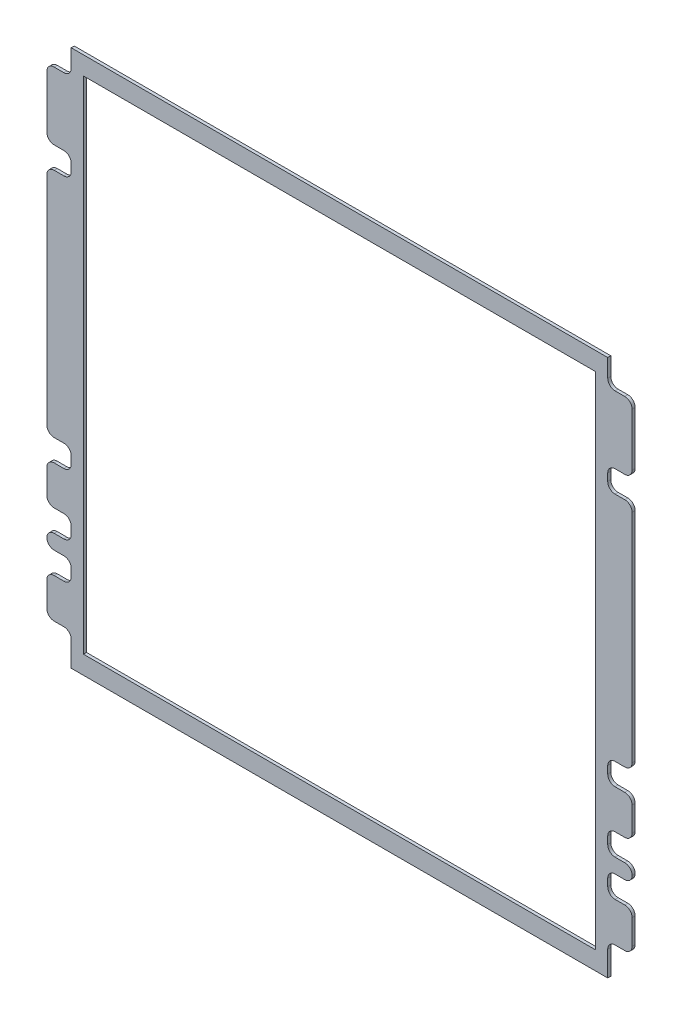
from build123d import *

# Parameters (mm, degrees)
SKETCH1_W           = 609.6
SKETCH1_H           = 559.70678
BOSS_EXTRUDE1_DEPTH = 3.175
SKETCH6_W           = 25.4
SKETCH6_H           = 33.599180378
SKETCH6_H_2         = 22.86
SKETCH6_H_3         = 26.284283972
CUT_EXTRUDE1_DEPTH  = 414.800725615
SKETCH7_W           = 533.4
SKETCH7_H           = 521.60678
CUT_EXTRUDE2_DEPTH  = 414.800725615
FILLET1_START       = -1
FILLET1_DEPTH       = 5
FILLET1_2_DEPTH     = 3.175


with BuildPart() as part:
    # Sketch1 → Boss-Extrude1 (new body)
    with BuildSketch(Plane.XY):
        Rectangle(SKETCH1_W, SKETCH1_H)
    extrude(amount=BOSS_EXTRUDE1_DEPTH)

    # Sketch6 → Cut-Extrude1 (cut, through all)
    with BuildSketch(Plane.XY.offset(3.175)):
        with Locations((292.1, -263.053799811)):
            Rectangle(SKETCH6_W, SKETCH6_H)
        with Locations((292.1, -193.67373)):
            Rectangle(SKETCH6_W, SKETCH6_H_2)
        with Locations((292.1, -155.57373)):
            Rectangle(SKETCH6_W, SKETCH6_H_2)
        with Locations((292.1, -92.07881)):
            Rectangle(SKETCH6_W, SKETCH6_H_2)
        with Locations((292.1, 171.90593)):
            Rectangle(SKETCH6_W, SKETCH6_H_2)
        with Locations((292.1, 266.711248014)):
            Rectangle(SKETCH6_W, SKETCH6_H_3)
    cut_extrude1 = extrude(amount=-CUT_EXTRUDE1_DEPTH, mode=Mode.SUBTRACT)

    # Sketch7 → Cut-Extrude2 (cut, through all)
    with BuildSketch(Plane.XY.offset(3.175)):
        Rectangle(SKETCH7_W, SKETCH7_H)
    extrude(amount=-CUT_EXTRUDE2_DEPTH, mode=Mode.SUBTRACT)

    # Mirror1: Cut-Extrude1 across plane
    add(cut_extrude1.mirror(Plane(origin=(0, 0, 0), x_dir=(0, 0, 1), z_dir=(1, 0, 0))), mode=Mode.SUBTRACT)

    # Fillet1: read off the stored shape, not the designer's step
    # Fillet1 outline → Fillet1 (cut)
    with BuildSketch(Plane.XY.offset(FILLET1_START)):
        with BuildLine():
            ThreePointArc((-297.18, -246.254209622), (-302.568153673, -244.022363295), (-304.8, -238.634209622))
            Line((-304.8, -238.634209622), (-304.8, -246.254209622))
            Line((-304.8, -246.254209622), (-297.18, -246.254209622))
        make_face()
        with BuildLine():
            ThreePointArc((-304.8, -212.72373), (-302.568153673, -207.335576327), (-297.18, -205.10373))
            Line((-297.18, -205.10373), (-304.8, -205.10373))
            Line((-304.8, -205.10373), (-304.8, -212.72373))
        make_face()
        with BuildLine():
            ThreePointArc((-297.18, -182.24373), (-302.568153673, -180.011883673), (-304.8, -174.62373))
            Line((-304.8, -174.62373), (-304.8, -182.24373))
            Line((-304.8, -182.24373), (-297.18, -182.24373))
        make_face()
        with BuildLine():
            ThreePointArc((-304.8, -174.62373), (-302.568153673, -169.235576327), (-297.18, -167.00373))
            Line((-297.18, -167.00373), (-304.8, -167.00373))
            Line((-304.8, -167.00373), (-304.8, -174.62373))
        make_face()
        with BuildLine():
            ThreePointArc((-297.18, -144.14373), (-302.568153673, -141.911883673), (-304.8, -136.52373))
            Line((-304.8, -136.52373), (-304.8, -144.14373))
            Line((-304.8, -144.14373), (-297.18, -144.14373))
        make_face()
        with BuildLine():
            ThreePointArc((-304.8, -111.12881), (-302.568153673, -105.740656327), (-297.18, -103.50881))
            Line((-297.18, -103.50881), (-304.8, -103.50881))
            Line((-304.8, -103.50881), (-304.8, -111.12881))
        make_face()
        with BuildLine():
            ThreePointArc((-297.18, -80.64881), (-302.568153673, -78.416963673), (-304.8, -73.02881))
            Line((-304.8, -73.02881), (-304.8, -80.64881))
            Line((-304.8, -80.64881), (-297.18, -80.64881))
        make_face()
        with BuildLine():
            ThreePointArc((-304.8, 152.85593), (-302.568153673, 158.244083673), (-297.18, 160.47593))
            Line((-297.18, 160.47593), (-304.8, 160.47593))
            Line((-304.8, 160.47593), (-304.8, 152.85593))
        make_face()
        with BuildLine():
            ThreePointArc((-297.18, 183.33593), (-302.568153673, 185.567776327), (-304.8, 190.95593))
            Line((-304.8, 190.95593), (-304.8, 183.33593))
            Line((-304.8, 183.33593), (-297.18, 183.33593))
        make_face()
        with BuildLine():
            ThreePointArc((-304.8, 245.949106028), (-302.568153672, 251.3372597), (-297.18, 253.569106028))
            Line((-297.18, 253.569106028), (-304.8, 253.569106028))
            Line((-304.8, 253.569106028), (-304.8, 245.949106028))
        make_face()
        with BuildLine():
            ThreePointArc((297.18, 253.569106028), (302.568153672, 251.3372597), (304.8, 245.949106028))
            Line((304.8, 245.949106028), (304.8, 253.569106028))
            Line((304.8, 253.569106028), (297.18, 253.569106028))
        make_face()
        with BuildLine():
            ThreePointArc((304.8, 190.95593), (302.568153673, 185.567776327), (297.18, 183.33593))
            Line((297.18, 183.33593), (304.8, 183.33593))
            Line((304.8, 183.33593), (304.8, 190.95593))
        make_face()
        with BuildLine():
            ThreePointArc((297.18, 160.47593), (302.568153673, 158.244083673), (304.8, 152.85593))
            Line((304.8, 152.85593), (304.8, 160.47593))
            Line((304.8, 160.47593), (297.18, 160.47593))
        make_face()
        with BuildLine():
            ThreePointArc((304.8, -73.02881), (302.568153673, -78.416963673), (297.18, -80.64881))
            Line((297.18, -80.64881), (304.8, -80.64881))
            Line((304.8, -80.64881), (304.8, -73.02881))
        make_face()
        with BuildLine():
            ThreePointArc((297.18, -103.50881), (302.568153673, -105.740656327), (304.8, -111.12881))
            Line((304.8, -111.12881), (304.8, -103.50881))
            Line((304.8, -103.50881), (297.18, -103.50881))
        make_face()
        with BuildLine():
            ThreePointArc((304.8, -136.52373), (302.568153673, -141.911883673), (297.18, -144.14373))
            Line((297.18, -144.14373), (304.8, -144.14373))
            Line((304.8, -144.14373), (304.8, -136.52373))
        make_face()
        with BuildLine():
            ThreePointArc((297.18, -167.00373), (302.568153673, -169.235576327), (304.8, -174.62373))
            Line((304.8, -174.62373), (304.8, -167.00373))
            Line((304.8, -167.00373), (297.18, -167.00373))
        make_face()
        with BuildLine():
            ThreePointArc((304.8, -174.62373), (302.568153673, -180.011883673), (297.18, -182.24373))
            Line((297.18, -182.24373), (304.8, -182.24373))
            Line((304.8, -182.24373), (304.8, -174.62373))
        make_face()
        with BuildLine():
            ThreePointArc((297.18, -205.10373), (302.568153673, -207.335576327), (304.8, -212.72373))
            Line((304.8, -212.72373), (304.8, -205.10373))
            Line((304.8, -205.10373), (297.18, -205.10373))
        make_face()
        with BuildLine():
            ThreePointArc((304.8, -238.634209622), (302.568153673, -244.022363295), (297.18, -246.254209622))
            Line((297.18, -246.254209622), (304.8, -246.254209622))
            Line((304.8, -246.254209622), (304.8, -238.634209622))
        make_face()
    extrude(amount=FILLET1_DEPTH, mode=Mode.SUBTRACT)

    # Fillet1 2 outline → Fillet1 2 (add)
    with BuildSketch(Plane.XY):
        with BuildLine():
            Line((-279.4, 253.569106028), (-279.4, 261.189106028))
            ThreePointArc((-279.4, 261.189106028), (-281.631846327, 255.800952355), (-287.02, 253.569106028))
            Line((-287.02, 253.569106028), (-279.4, 253.569106028))
        make_face()
        with BuildLine():
            Line((-279.4, -246.254209622), (-287.02, -246.254209622))
            ThreePointArc((-287.02, -246.254209622), (-281.631846327, -248.48605595), (-279.4, -253.874209622))
            Line((-279.4, -253.874209622), (-279.4, -246.254209622))
        make_face()
        with BuildLine():
            Line((-279.4, -205.10373), (-279.4, -197.48373))
            ThreePointArc((-279.4, -197.48373), (-281.631846327, -202.871883673), (-287.02, -205.10373))
            Line((-287.02, -205.10373), (-279.4, -205.10373))
        make_face()
        with BuildLine():
            Line((-279.4, -182.24373), (-287.02, -182.24373))
            ThreePointArc((-287.02, -182.24373), (-281.631846327, -184.475576327), (-279.4, -189.86373))
            Line((-279.4, -189.86373), (-279.4, -182.24373))
        make_face()
        with BuildLine():
            Line((-279.4, -167.00373), (-279.4, -159.38373))
            ThreePointArc((-279.4, -159.38373), (-281.631846327, -164.771883673), (-287.02, -167.00373))
            Line((-287.02, -167.00373), (-279.4, -167.00373))
        make_face()
        with BuildLine():
            Line((-279.4, -144.14373), (-287.02, -144.14373))
            ThreePointArc((-287.02, -144.14373), (-281.631846327, -146.375576327), (-279.4, -151.76373))
            Line((-279.4, -151.76373), (-279.4, -144.14373))
        make_face()
        with BuildLine():
            Line((-279.4, -103.50881), (-279.4, -95.88881))
            ThreePointArc((-279.4, -95.88881), (-281.631846327, -101.276963673), (-287.02, -103.50881))
            Line((-287.02, -103.50881), (-279.4, -103.50881))
        make_face()
        with BuildLine():
            Line((-279.4, -80.64881), (-287.02, -80.64881))
            ThreePointArc((-287.02, -80.64881), (-281.631846327, -82.880656327), (-279.4, -88.26881))
            Line((-279.4, -88.26881), (-279.4, -80.64881))
        make_face()
        with BuildLine():
            Line((-279.4, 160.47593), (-279.4, 168.09593))
            ThreePointArc((-279.4, 168.09593), (-281.631846327, 162.707776327), (-287.02, 160.47593))
            Line((-287.02, 160.47593), (-279.4, 160.47593))
        make_face()
        with BuildLine():
            Line((-279.4, 183.33593), (-287.02, 183.33593))
            ThreePointArc((-287.02, 183.33593), (-281.631846327, 181.104083673), (-279.4, 175.71593))
            Line((-279.4, 175.71593), (-279.4, 183.33593))
        make_face()
        with BuildLine():
            Line((279.4, -246.254209622), (279.4, -253.874209622))
            ThreePointArc((279.4, -253.874209622), (281.631846327, -248.48605595), (287.02, -246.254209622))
            Line((287.02, -246.254209622), (279.4, -246.254209622))
        make_face()
        with BuildLine():
            Line((279.4, 253.569106028), (287.02, 253.569106028))
            ThreePointArc((287.02, 253.569106028), (281.631846327, 255.800952355), (279.4, 261.189106028))
            Line((279.4, 261.189106028), (279.4, 253.569106028))
        make_face()
        with BuildLine():
            Line((279.4, 183.33593), (279.4, 175.71593))
            ThreePointArc((279.4, 175.71593), (281.631846327, 181.104083673), (287.02, 183.33593))
            Line((287.02, 183.33593), (279.4, 183.33593))
        make_face()
        with BuildLine():
            Line((279.4, 160.47593), (287.02, 160.47593))
            ThreePointArc((287.02, 160.47593), (281.631846327, 162.707776327), (279.4, 168.09593))
            Line((279.4, 168.09593), (279.4, 160.47593))
        make_face()
        with BuildLine():
            Line((279.4, -80.64881), (279.4, -88.26881))
            ThreePointArc((279.4, -88.26881), (281.631846327, -82.880656327), (287.02, -80.64881))
            Line((287.02, -80.64881), (279.4, -80.64881))
        make_face()
        with BuildLine():
            Line((279.4, -103.50881), (287.02, -103.50881))
            ThreePointArc((287.02, -103.50881), (281.631846327, -101.276963673), (279.4, -95.88881))
            Line((279.4, -95.88881), (279.4, -103.50881))
        make_face()
        with BuildLine():
            Line((279.4, -144.14373), (279.4, -151.76373))
            ThreePointArc((279.4, -151.76373), (281.631846327, -146.375576327), (287.02, -144.14373))
            Line((287.02, -144.14373), (279.4, -144.14373))
        make_face()
        with BuildLine():
            Line((279.4, -167.00373), (287.02, -167.00373))
            ThreePointArc((287.02, -167.00373), (281.631846327, -164.771883673), (279.4, -159.38373))
            Line((279.4, -159.38373), (279.4, -167.00373))
        make_face()
        with BuildLine():
            Line((279.4, -182.24373), (279.4, -189.86373))
            ThreePointArc((279.4, -189.86373), (281.631846327, -184.475576327), (287.02, -182.24373))
            Line((287.02, -182.24373), (279.4, -182.24373))
        make_face()
        with BuildLine():
            Line((279.4, -205.10373), (287.02, -205.10373))
            ThreePointArc((287.02, -205.10373), (281.631846327, -202.871883673), (279.4, -197.48373))
            Line((279.4, -197.48373), (279.4, -205.10373))
        make_face()
    extrude(amount=FILLET1_2_DEPTH)


solid = part.part
